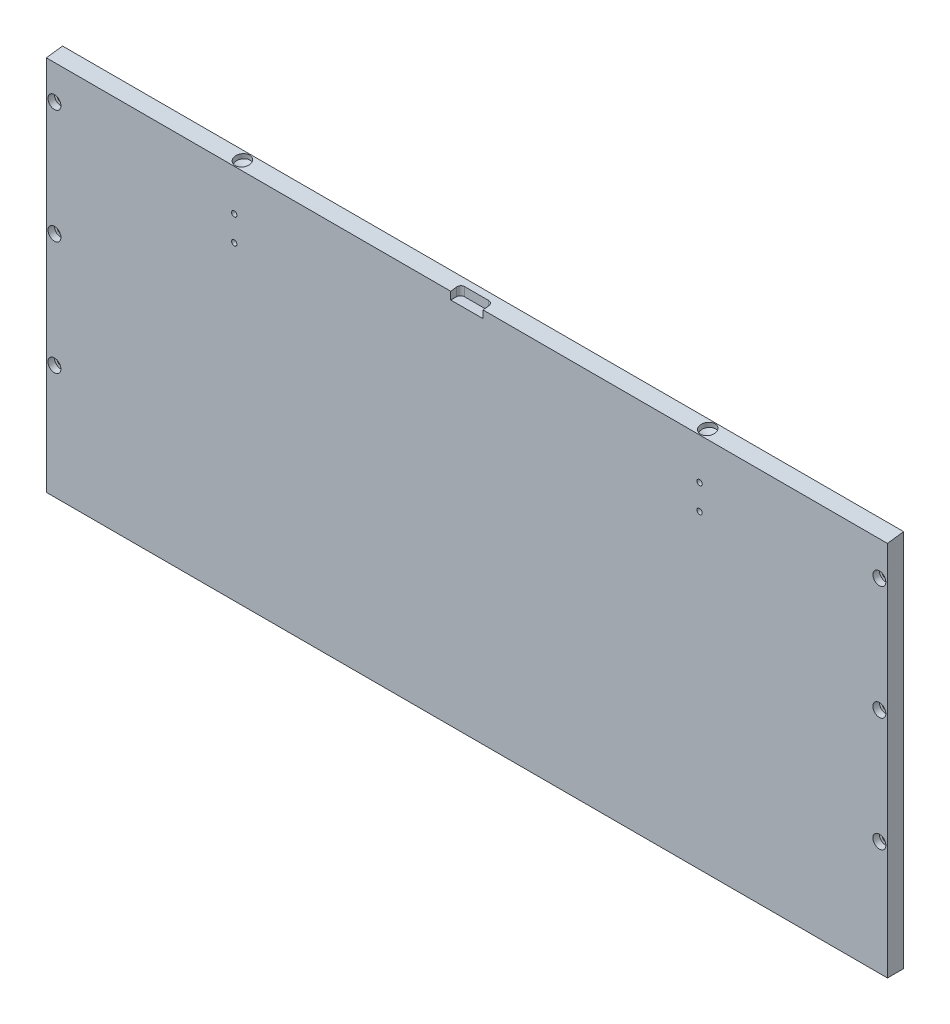
from build123d import *

# Parameters (mm, degrees)
SKETCH1_W                     = 520
SKETCH1_H                     = 234
BOSS_EXTRUDE1_DEPTH           = 10
SKETCH8_W                     = 20
SKETCH8_H                     = 8
CUT_EXTRUDE5_DEPTH            = 6
FILLET2_R                     = 2.5
CUT_EXTRUDE7_DEPTH            = 571.312195205
M4X0_7_TAPPED_HOLE1_D         = 3.3
M4X0_7_TAPPED_HOLE1_DEPTH     = 12
M4X0_7_TAPPED_HOLE1_TIP       = 0.991420021
CBORE_FOR_M4_SHCS1_AT_2_COUNT = 2
CBORE_FOR_M4_SHCS1_AT_2_PITCH = 70.5
CBORE_FOR_M4_SHCS1_AT_3_COUNT = 2
CBORE_FOR_M4_SHCS1_AT_3_PITCH = 141
M4X0_7_TAPPED_HOLE2_D         = 3.3


with BuildPart() as part:
    # Sketch1 → Boss-Extrude1 (new body)
    with BuildSketch(Plane.XY):
        with Locations((260, 117)):
            Rectangle(SKETCH1_W, SKETCH1_H)
    extrude(amount=BOSS_EXTRUDE1_DEPTH)

    # Sketch8 → Cut-Extrude5 (cut)
    with BuildSketch(Plane.XY.offset(10)):
        with Locations((260, 232)):
            Rectangle(SKETCH8_W, SKETCH8_H)
    extrude(amount=-CUT_EXTRUDE5_DEPTH, mode=Mode.SUBTRACT)

    # Fillet2
    fillet2_edges = [part.edges().sort_by_distance(p)[0] for p in [
        (270, 231, 4),
        (250, 231, 4),
    ]]
    fillet(fillet2_edges, radius=FILLET2_R)

    # Sketch9 → Cut-Extrude7 (cut, through all)
    with BuildSketch(Plane(origin=(0, 0, 0), x_dir=(0, 0, -1), z_dir=(1, 0, 0))):
        Polygon((0, 234), (-10, 232.685250563), (-10, 234), align=None)
    extrude(amount=CUT_EXTRUDE7_DEPTH, mode=Mode.SUBTRACT)

    # M4x0.7 Tapped Hole1
    with Locations(Plane(origin=(0, 0, 0), x_dir=(-1, 0, 0), z_dir=(0, -1, 0))):
        with Locations((-70, -5), (-260, -5), (-450, -5)):
            Hole(M4X0_7_TAPPED_HOLE1_D / 2, depth=M4X0_7_TAPPED_HOLE1_DEPTH)
            with Locations((0, 0, -(M4X0_7_TAPPED_HOLE1_DEPTH + M4X0_7_TAPPED_HOLE1_TIP / 2))):  # 118° drill point
                Cone(0, M4X0_7_TAPPED_HOLE1_D / 2, M4X0_7_TAPPED_HOLE1_TIP, mode=Mode.SUBTRACT)

    # Sketch13 → CBORE for M4 SHCS1 (revolve, cut)
    with BuildSketch(Plane(origin=(5, 211.5, 10), x_dir=(0, -1, 0), z_dir=(1, 0, 0))):
        Polygon((0, 0), (0, 13.351936393), (2.25, 12), (2.25, 4), (4, 4), (4, 0), align=None)
    cbore_for_m4_shcs1 = revolve(axis=Axis((5, 211.5, 16.35), (0, 0, -1)), mode=Mode.SUBTRACT)

    # CBORE for M4 SHCS1 at 2: CBORE for M4 SHCS1 ×2
    with Locations(*[(0, -i * CBORE_FOR_M4_SHCS1_AT_2_PITCH, 0) for i in range(1, CBORE_FOR_M4_SHCS1_AT_2_COUNT)]):
        add(cbore_for_m4_shcs1, mode=Mode.SUBTRACT)

    # CBORE for M4 SHCS1 at 3: CBORE for M4 SHCS1 ×2
    with Locations(*[(0, -i * CBORE_FOR_M4_SHCS1_AT_3_PITCH, 0) for i in range(1, CBORE_FOR_M4_SHCS1_AT_3_COUNT)]):
        add(cbore_for_m4_shcs1, mode=Mode.SUBTRACT)

    # Mirror1: CBORE for M4 SHCS1 across plane
    add(cbore_for_m4_shcs1.mirror(Plane.ZY.offset(-260)), mode=Mode.SUBTRACT)

    # Mirror1 copy 1 sketch → Mirror1 copy 1 (revolve, cut)
    with BuildSketch(Plane(origin=(515, 141, 10), x_dir=(0, -1, 0), z_dir=(-1, 0, 0))):
        Polygon((0, 0), (0, -13.351936393), (2.25, -12), (2.25, -4), (4, -4), (4, 0), align=None)
    revolve(axis=Axis((515, 141, 16.35), (0, 0, 1)), mode=Mode.SUBTRACT)

    # Mirror1 copy 2 sketch → Mirror1 copy 2 (revolve, cut)
    with BuildSketch(Plane(origin=(515, 70.5, 10), x_dir=(0, -1, 0), z_dir=(-1, 0, 0))):
        Polygon((0, 0), (0, -13.351936393), (2.25, -12), (2.25, -4), (4, -4), (4, 0), align=None)
    revolve(axis=Axis((515, 70.5, 16.35), (0, 0, 1)), mode=Mode.SUBTRACT)

    # M4x0.7 Tapped Hole2 (through all)
    with Locations(Plane.XY.offset(10)):
        with Locations((116.15, 207.185250563), (116.15, 191.685250563)):
            m4x0_7_tapped_hole2 = Hole(M4X0_7_TAPPED_HOLE2_D / 2)

    # Mirror2: M4x0.7 Tapped Hole2 across plane
    add(m4x0_7_tapped_hole2.mirror(Plane.ZY.offset(-260)), mode=Mode.SUBTRACT)

    # Sketch17 → Ø9.0 (9) Diameter Hole1 (revolve, cut)
    with BuildSketch(Plane(origin=(116.15, 233.348234248, 4.957338137), x_dir=(0, -0.1303531504610662, 0.9914676273912701), z_dir=(1, 0, 0))):
        Polygon((0, 0), (0, 5.703872786), (4.5, 3), (4.5, 0), align=None)
    f_9_0_9_diameter_hole1 = revolve(axis=Axis((116.15, 239.644053682, 5.785080642), (0, -0.9914676273912703, -0.13035315046106621)), mode=Mode.SUBTRACT)

    # Mirror5: Ø9.0 (9) Diameter Hole1 across plane
    add(f_9_0_9_diameter_hole1.mirror(Plane.ZY.offset(-260)), mode=Mode.SUBTRACT)


solid = part.part
